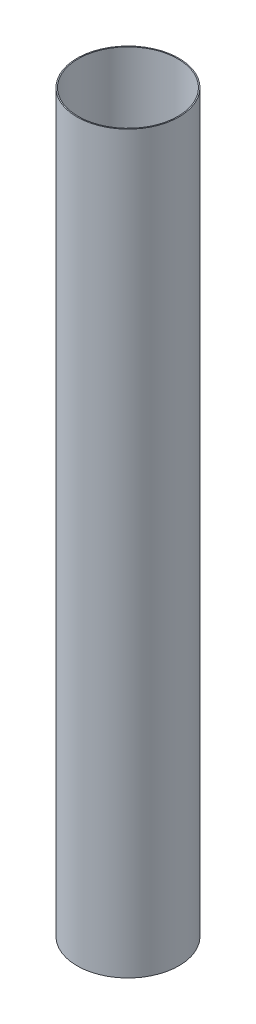
from build123d import *

# Parameters (mm, degrees)
SKETCH5_R           = 49.276
SKETCH5_R_2         = 48.26
BOSS_EXTRUDE1_DEPTH = 711.2


with BuildPart() as part:
    # Sketch5 → Boss-Extrude1 (new body)
    with BuildSketch(Plane(origin=(0, 0, 0), x_dir=(1, 0, 0), z_dir=(0, 1, 0))):
        Circle(SKETCH5_R)
        Circle(SKETCH5_R_2, mode=Mode.SUBTRACT)
    extrude(amount=-BOSS_EXTRUDE1_DEPTH)


solid = part.part
